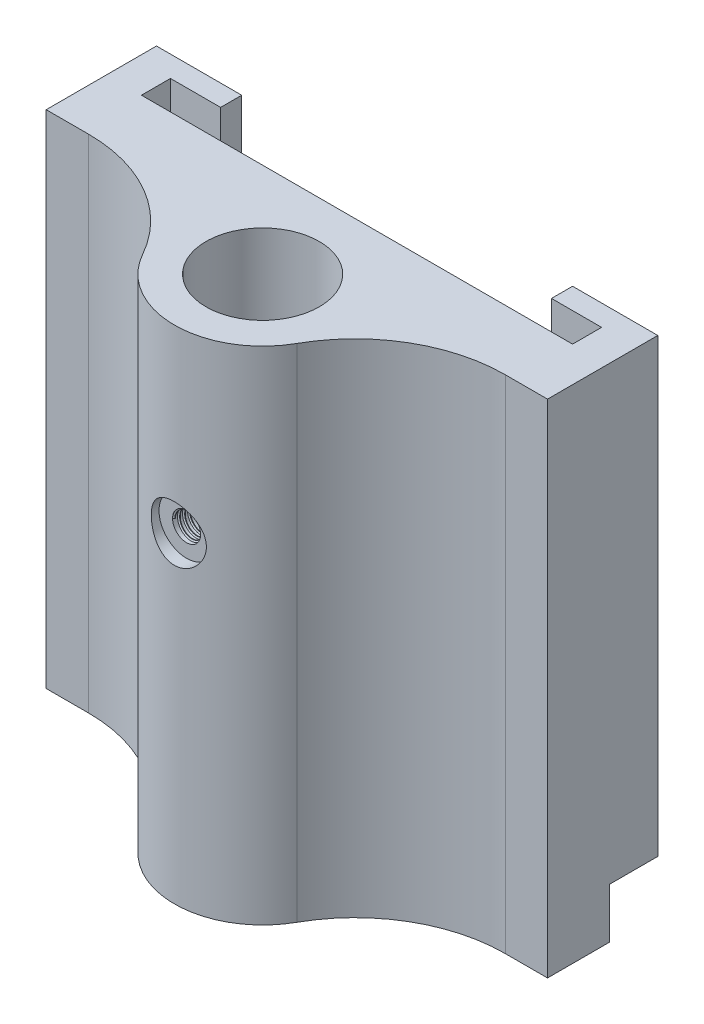
from build123d import *

# Parameters (mm, degrees)
BOSS_EXTRUDE1_DEPTH = 50
SKETCH2_W           = 50
SKETCH2_H           = 4.8
CUT_EXTRUDE1_DEPTH  = 5
SKETCH3_R           = 5.3
CUT_EXTRUDE2_DEPTH  = 72.561162651
BOSS_EXTRUDE2_DEPTH = 50
FILLET1_R           = 15
SKETCH6_R           = 1.4
CUT_EXTRUDE4_DEPTH  = 10
SKETCH7_R           = 2.75
CUT_EXTRUDE5_DEPTH  = 5
THREAD1_PITCH       = 0.5
SKETCH9_R           = 5.65
CUT_EXTRUDE6_DEPTH  = 10


with BuildPart() as part:
    # Sketch1 → Boss-Extrude1 (new body)
    with BuildSketch(Plane(origin=(0, 0, 0), x_dir=(1, 0, 0), z_dir=(0, 1, 0))):
        Polygon((8.5, 0), (0, 0), (0, -11), (50, -11), (50, 0), (41.5, 0), (41.5, -2.104480912), (46.5, -2.104480912), (46.5, -5), (3.5, -5), (3.5, -2.104480912), (8.5, -2.104480912), align=None)
    extrude(amount=BOSS_EXTRUDE1_DEPTH)

    # Sketch2 → Cut-Extrude1 (cut)
    with BuildSketch(Plane.XZ):
        with Locations((25, 2.4)):
            Rectangle(SKETCH2_W, SKETCH2_H)
    extrude(amount=-CUT_EXTRUDE1_DEPTH, mode=Mode.SUBTRACT)

    # Sketch3 → Cut-Extrude2 (cut, through all)
    with BuildSketch(Plane(origin=(0, 50, 0), x_dir=(1, 0, 0), z_dir=(0, 1, 0))):
        with Locations((25, -14.412334908)):
            Circle(SKETCH3_R)
    extrude(amount=-CUT_EXTRUDE2_DEPTH, mode=Mode.SUBTRACT)

    # Sketch5 → Boss-Extrude2 (add)
    with BuildSketch(Plane(origin=(0, 50, 0), x_dir=(1, 0, 0), z_dir=(0, 1, 0))):
        with BuildLine():
            Line((16.888528464, -11), (20.944636826, -11))
            ThreePointArc((20.944636826, -11), (25, -19.712334908), (29.055363174, -11))
            Line((29.055363174, -11), (33.111471536, -11))
            ThreePointArc((33.111471536, -11), (25, -23.212334908), (16.888528464, -11))
        make_face()
    extrude(amount=-BOSS_EXTRUDE2_DEPTH)

    # Fillet1
    fillet1_edges = [part.edges().sort_by_distance(p)[0] for p in [
        (33.111471536, 25, 11),
        (16.888528464, 25, 11),
    ]]
    fillet(fillet1_edges, radius=FILLET1_R)

    # Sketch6 → Cut-Extrude4 (cut)
    with BuildSketch(Plane.XY.offset(27)):
        with Locations((25, 32)):
            Circle(SKETCH6_R)
    extrude(amount=-CUT_EXTRUDE4_DEPTH, mode=Mode.SUBTRACT)

    # Sketch7 → Cut-Extrude5 (cut)
    with BuildSketch(Plane.XY.offset(27)):
        with Locations((25, 32)):
            Circle(SKETCH7_R)
    extrude(amount=-CUT_EXTRUDE5_DEPTH, mode=Mode.SUBTRACT)

    # Thread1: the profile of Thread Profile1 profile screwed along a right-hand helix of 4.4 turns, 6 arcs to a turn; built about Z, then put on its axis
    thread1_z = Axis((0, 0, 0), (0, 0, 1))
    thread1_corners = [(1.4003, 0, -0.000173205), (1.4003, 0, 0.218923204), (1.264683531, 0, 0.140625), (1.264683531, 0, 0.078125)]
    with BuildLine(mode=Mode.PRIVATE) as thread1_profile:
        Line(thread1_corners[0], thread1_corners[1])
        Line(thread1_corners[1], thread1_corners[2])
        Line(thread1_corners[2], thread1_corners[3])
        Line(thread1_corners[3], thread1_corners[0])
    thread1_cap = Face(thread1_profile.wire())
    thread1_turn_angles = [0, 30, 60, 90, 120, 150, 180, 210, 240, 270, 300, 330, 360]
    thread1_turn_weights = [1, 0.8660254037844387, 1, 0.8660254037844387, 1, 0.8660254037844387, 1, 0.8660254037844387, 1, 0.8660254037844387, 1, 0.8660254037844387, 1]
    thread1_turn_rails = [Edge.make_bspline([Vector(p[0], p[1], 0).rotate(thread1_z, thread1_turn_angles[k]) / thread1_turn_weights[k] + Vector(0, 0, p[2] + THREAD1_PITCH * thread1_turn_angles[k] / 360) for k in range(13)], [0, 0, 0, 1, 1, 2, 2, 3, 3, 4, 4, 5, 5, 6, 6, 6], 2, thread1_turn_weights) for p in thread1_corners]
    thread1_turn_sides = [Face.make_surface_from_curves(thread1_turn_rails[p[0]], thread1_turn_rails[p[1]]) for p in [(0, 1), (1, 2), (2, 3), (3, 0)]]
    thread1_last_angles = [1440, 1470, 1500, 1530, 1560, 1572, 1584]
    thread1_last_weights = [1, 0.8660254037844387, 1, 0.8660254037844387, 1, 0.9781476007338052, 1]
    thread1_last_rails = [Edge.make_bspline([Vector(p[0], p[1], 0).rotate(thread1_z, thread1_last_angles[k]) / thread1_last_weights[k] + Vector(0, 0, p[2] + THREAD1_PITCH * thread1_last_angles[k] / 360) for k in range(7)], [0, 0, 0, 1, 1, 2, 2, 3, 3, 3], 2, thread1_last_weights) for p in thread1_corners]
    thread1_last_sides = [Face.make_surface_from_curves(thread1_last_rails[p[0]], thread1_last_rails[p[1]]) for p in [(0, 1), (1, 2), (2, 3), (3, 0)]]
    thread1 = Plane(origin=(25, 32, 22), x_dir=(-1, 0, 0), z_dir=(0, 0, -1)) * Solid(Shell([*[p.moved(Location((0, 0, THREAD1_PITCH * i))) for i in range(4) for p in thread1_turn_sides], *thread1_last_sides, thread1_cap, thread1_cap.rotate(thread1_z, 1584).moved(Location((0, 0, THREAD1_PITCH * 1584 / 360)))]))
    add(thread1)

    # Sketch9 → Cut-Extrude6 (cut)
    with BuildSketch(Plane(origin=(0, 50, 0), x_dir=(1, 0, 0), z_dir=(0, 1, 0))):
        with Locations(Location((25, -14.412334908, 0), (0, 0, 270))):
            Circle(SKETCH9_R)
    extrude(amount=-CUT_EXTRUDE6_DEPTH, mode=Mode.SUBTRACT)


solid = part.part
